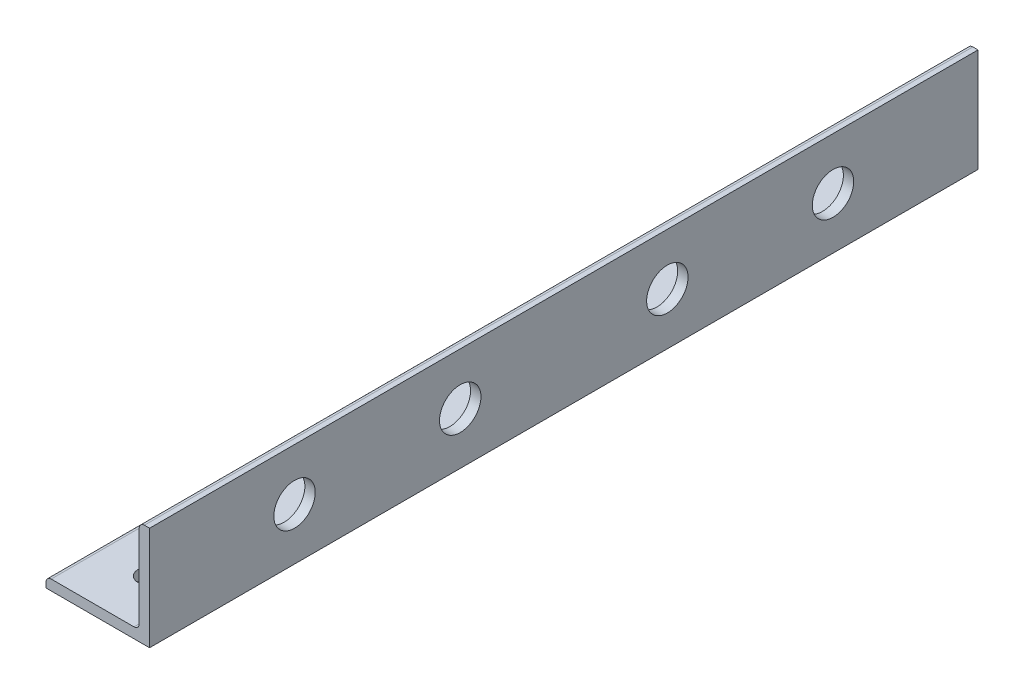
from build123d import *

# Parameters (mm, degrees)
BOSS_EXTRUDE1_DEPTH = 63.5
SKETCH3_R           = 3.175
CUT_EXTRUDE1_DEPTH  = 68.351920908
SKETCH4_R           = 1.7500092
CUT_EXTRUDE2_DEPTH  = 66.933826912


with BuildPart() as part:
    # Sketch2 → Boss-Extrude1 (new, symmetric)
    with BuildSketch(Plane.XY):
        with BuildLine():
            Line((-7.9375, 0), (7.9375, 0))
            Line((7.9375, 0), (7.9375, 15.875))
            Line((7.9375, 15.875), (7.14375, 15.875))
            ThreePointArc((7.14375, 15.875), (6.582483992, 15.642516008), (6.35, 15.08125))
            Line((6.35, 15.08125), (6.35, 2.38125))
            ThreePointArc((6.35, 2.38125), (6.117516008, 1.819983992), (5.55625, 1.5875))
            Line((5.55625, 1.5875), (-7.14375, 1.5875))
            ThreePointArc((-7.14375, 1.5875), (-7.705016008, 1.355016008), (-7.9375, 0.79375))
            Line((-7.9375, 0.79375), (-7.9375, 0))
        make_face()
    extrude(amount=BOSS_EXTRUDE1_DEPTH, both=True)

    # Sketch3 → Cut-Extrude1 (cut, through all)
    with BuildSketch(Plane(origin=(7.9375, 0, 0), x_dir=(0, 0, -1), z_dir=(1, 0, 0))):
        with Locations((-41.275, 7.9375)):
            Circle(SKETCH3_R)
        with Locations((41.275, 7.9375)):
            Circle(SKETCH3_R)
        with Locations((-15.875, 7.9375)):
            Circle(SKETCH3_R)
        with Locations((15.875, 7.9375)):
            Circle(SKETCH3_R)
    extrude(amount=-CUT_EXTRUDE1_DEPTH, mode=Mode.SUBTRACT)

    # Sketch4 → Cut-Extrude2 (cut, through all)
    with BuildSketch(Plane.XZ):
        with Locations((0, 55.5625)):
            Circle(SKETCH4_R)
        with Locations((0, -55.5625)):
            Circle(SKETCH4_R)
    extrude(amount=-CUT_EXTRUDE2_DEPTH, mode=Mode.SUBTRACT)


solid = part.part
